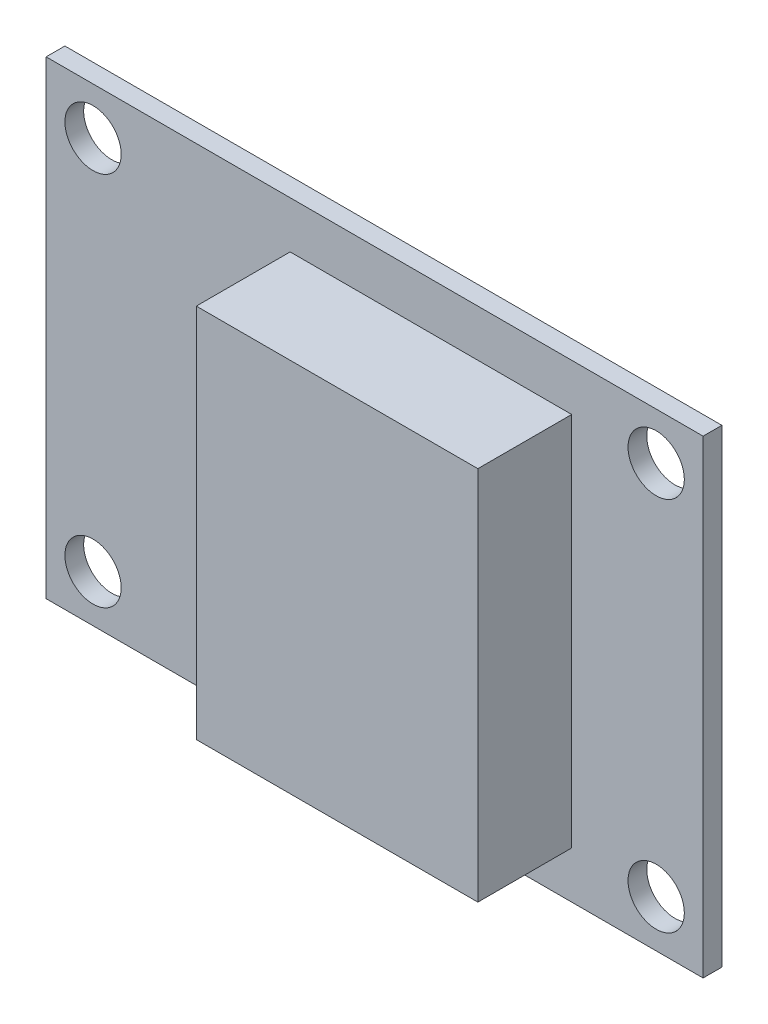
from build123d import *

# Parameters (mm, degrees)
SKETCH1_W           = 35
SKETCH1_H           = 25
BOSS_EXTRUDE1_DEPTH = 1
SKETCH2_W           = 15
SKETCH2_H           = 20
BOSS_EXTRUDE2_DEPTH = 5
SKETCH3_R           = 1.5
CUT_EXTRUDE1_DEPTH  = 23.079402166


with BuildPart() as part:
    # Sketch1 → Boss-Extrude1 (new body)
    with BuildSketch(Plane.XY):
        Rectangle(SKETCH1_W, SKETCH1_H)
    extrude(amount=BOSS_EXTRUDE1_DEPTH)

    # Sketch2 → Boss-Extrude2 (add)
    with BuildSketch(Plane.XY.offset(1)):
        with Locations((3, 0)):
            Rectangle(SKETCH2_W, SKETCH2_H)
    extrude(amount=BOSS_EXTRUDE2_DEPTH)

    # Sketch3 → Cut-Extrude1 (cut, through all)
    with BuildSketch(Plane.XY.offset(1)):
        with Locations((-15, 10)):
            Circle(SKETCH3_R)
        with Locations((-15, -10)):
            Circle(SKETCH3_R)
        with Locations((15, -10)):
            Circle(SKETCH3_R)
        with Locations((15, 10)):
            Circle(SKETCH3_R)
    extrude(amount=-CUT_EXTRUDE1_DEPTH, mode=Mode.SUBTRACT)


solid = part.part
